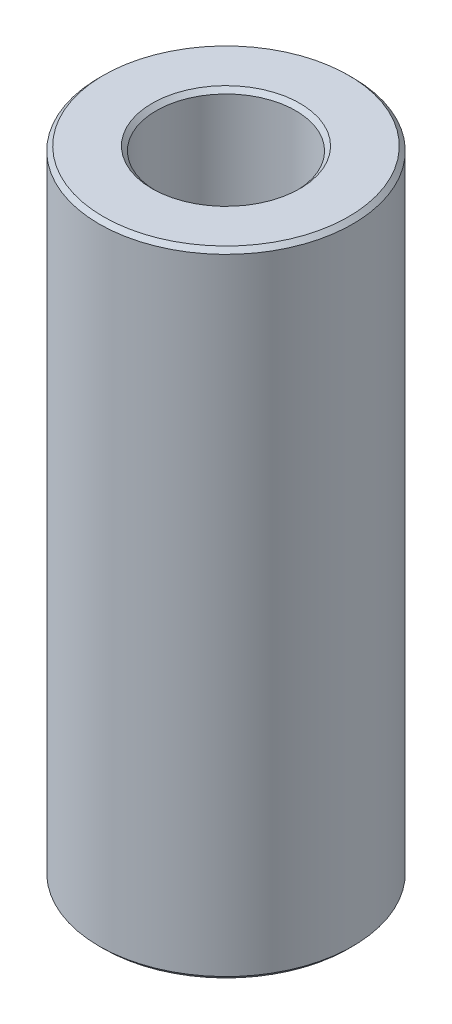
from build123d import *

# Parameters (mm, degrees)
SKETCH1_R            = 6
BOSS_EXTRUDE1_DEPTH  = 30
M6_CLEARANCE_HOLE1_D = 6.6
CHAMFER1_SIZE        = 0.2


with BuildPart() as part:
    # Sketch1 → Boss-Extrude1 (new body)
    with BuildSketch(Plane(origin=(0, 0, 0), x_dir=(1, 0, 0), z_dir=(0, 1, 0))):
        Circle(SKETCH1_R)
    extrude(amount=BOSS_EXTRUDE1_DEPTH)

    # M6 Clearance Hole1 (through all)
    with Locations(Plane(origin=(0, 30, 0), x_dir=(1, 0, 0), z_dir=(0, 1, 0))):
        with Locations((0, 0)):
            Hole(M6_CLEARANCE_HOLE1_D / 2)

    # Chamfer1
    chamfer1_edges = [part.edges().sort_by_distance(p)[0] for p in [
        (-6, 0, 0),
        (-6, 30, 0),
        (3.3, 0, 0),
        (3.3, 30, 0),
    ]]
    chamfer(chamfer1_edges, length=CHAMFER1_SIZE)


solid = part.part
